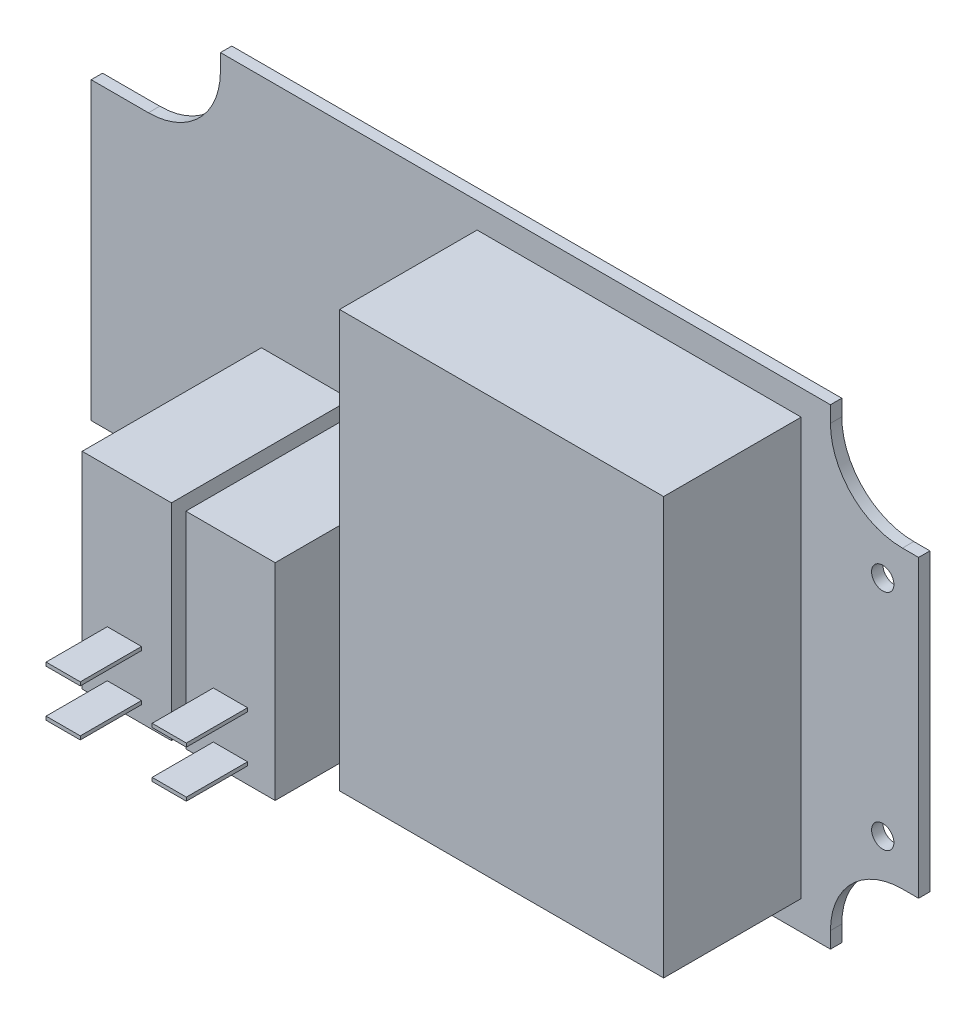
from build123d import *

# Parameters (mm, degrees)
SKETCH1_R           = 1.55
BOSS_EXTRUDE1_DEPTH = 1.5748
SKETCH2_W           = 12.4
SKETCH2_H           = 28.6
BOSS_EXTRUDE2_DEPTH = 24.9
SKETCH3_W           = 4.75
SKETCH3_H           = 0.5
BOSS_EXTRUDE3_DEPTH = 8.5
SKETCH4_W           = 45
SKETCH4_H           = 57.9
BOSS_EXTRUDE4_DEPTH = 19.1


with BuildPart() as part:
    # Sketch1 → Boss-Extrude1 (new body)
    with BuildSketch(Plane.XY):
        with BuildLine():
            Line((42.354093023, -30.703264053), (42.354093023, -32.943264053))
            Line((42.354093023, -32.943264053), (-42.354093023, -32.943264053))
            Line((-42.354093023, -32.943264053), (-42.354093023, -30.703264053))
            ThreePointArc((-42.354093023, -30.703264053), (-45.283025211, -23.632196241), (-52.354093023, -20.703264053))
            Line((-52.354093023, -20.703264053), (-60.301272865, -20.703264053))
            Line((-60.301272865, -20.703264053), (-60.301272865, 20.296735947))
            Line((-60.301272865, 20.296735947), (-52.354093023, 20.296735947))
            ThreePointArc((-52.354093023, 20.296735947), (-45.283025211, 23.225668135), (-42.354093023, 30.296735947))
            Line((-42.354093023, 30.296735947), (-42.354093023, 32.536735947))
            Line((-42.354093023, 32.536735947), (42.354093023, 32.536735947))
            Line((42.354093023, 32.536735947), (42.354093023, 30.296735947))
            ThreePointArc((42.354093023, 30.296735947), (45.283025211, 23.225668135), (52.354093023, 20.296735947))
            Line((52.354093023, 20.296735947), (54.593335979, 20.296735947))
            Line((54.593335979, 20.296735947), (54.593335979, -20.703264053))
            Line((54.593335979, -20.703264053), (52.354093023, -20.703264053))
            ThreePointArc((52.354093023, -20.703264053), (45.283025211, -23.632196241), (42.354093023, -30.703264053))
        make_face()
        with Locations((49.618335979, -15.728264053)):
            Circle(SKETCH1_R, mode=Mode.SUBTRACT)
        with Locations((49.618335979, 15.321735947)):
            Circle(SKETCH1_R, mode=Mode.SUBTRACT)
    extrude(amount=BOSS_EXTRUDE1_DEPTH)

    # Sketch2 → Boss-Extrude2 (add)
    with BuildSketch(Plane.XY.offset(1.5748)):
        with Locations((-30.457181744, -14.416216189)):
            Rectangle(SKETCH2_W, SKETCH2_H)
        with Locations((-16.057181744, -14.416216189)):
            Rectangle(SKETCH2_W, SKETCH2_H)
    extrude(amount=BOSS_EXTRUDE2_DEPTH)

    # Sketch3 → Boss-Extrude3 (add)
    with BuildSketch(Plane.XY.offset(26.4748)):
        with Locations((-16.064182879, -26.220731539)):
            Rectangle(SKETCH3_W, SKETCH3_H)
        with Locations((-16.064182879, -19.720731539)):
            Rectangle(SKETCH3_W, SKETCH3_H)
        with Locations((-30.792693371, -26.220731539)):
            Rectangle(SKETCH3_W, SKETCH3_H)
        with Locations((-30.792693371, -19.720731539)):
            Rectangle(SKETCH3_W, SKETCH3_H)
    extrude(amount=BOSS_EXTRUDE3_DEPTH)

    # Sketch4 → Boss-Extrude4 (add)
    with BuildSketch(Plane.XY.offset(1.5748)):
        with Locations((15.786645431, 0.061567403)):
            Rectangle(SKETCH4_W, SKETCH4_H)
    extrude(amount=BOSS_EXTRUDE4_DEPTH)


solid = part.part
